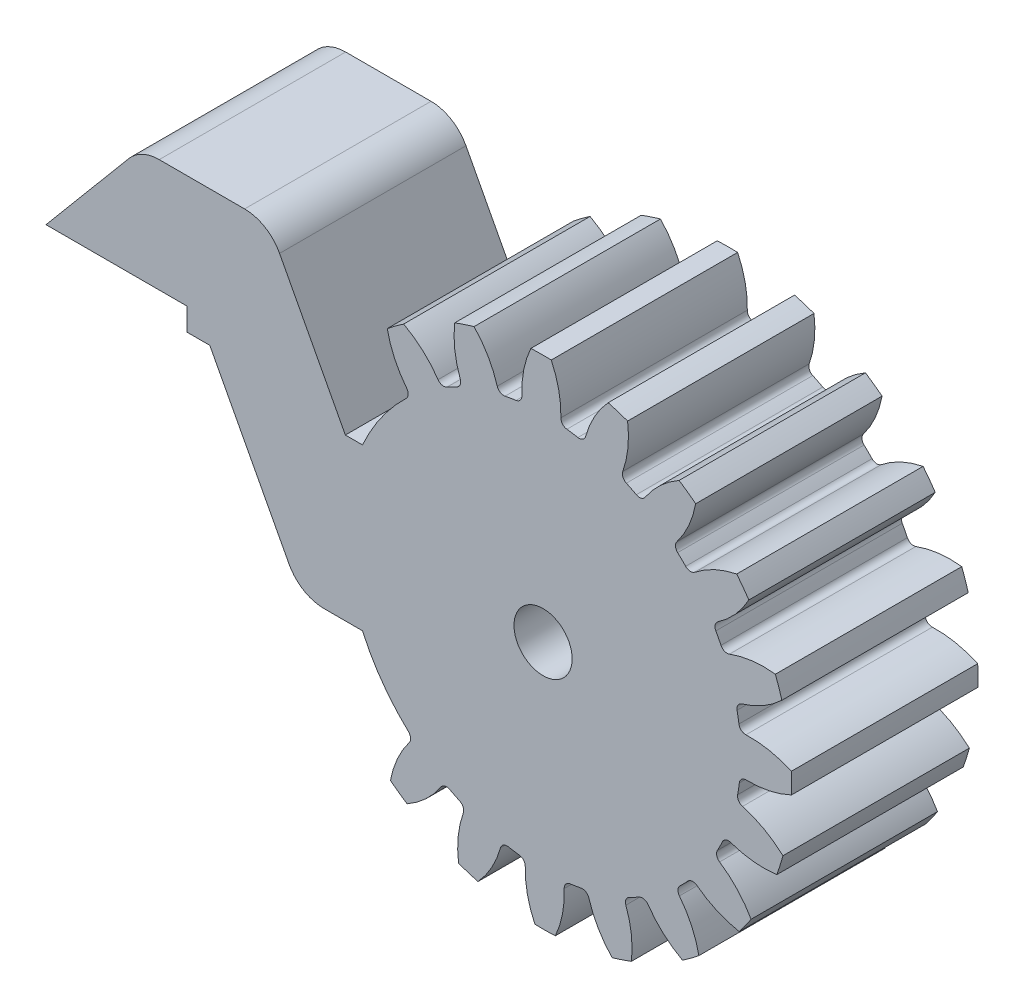
from build123d import *
from build123d.topology import SkipClean

# Parameters (mm, degrees)
BOSS_EXTRUDE1_DEPTH         = 16.5
FILLET1_R                   = 3.5
FINGER_GEARB_START          = -3.650955648
FINGER_GEARB_OUTLINE_R      = 2.575
FINGER_GEARB_DEPTH          = 16.5
BODY_MOVE_COPY1_START       = -3.650955648
BODY_MOVE_COPY1_OUTLINE_R   = 2.575
BODY_MOVE_COPY1_DEPTH       = 16.5
BODY_MOVE_COPY1_2_DEPTH     = 3.650955648
BODY_MOVE_COPY1_3_OUTLINE_R = 2.575
BODY_MOVE_COPY1_3_DEPTH     = 16.5
BOSS_EXTRUDE2_START         = 1.5
SKETCH2_R                   = 6
SKETCH2_R_2                 = 2.575
BOSS_EXTRUDE2_DEPTH         = 1.5


# Read off the part's stored shape, not the designer's step: Finger_GearB, Body-Move/Copy1
with BuildPart() as part:
    # Sketch1 → Boss-Extrude1 (new body)
    with BuildSketch(Plane.XY):
        Polygon((-22.5, 17.125), (-10, 17.125), (-10, 15.125), (-8, 15.125), (0, 0), (4, 0), (4, 14.25), (-2.809917355, 27.125), (-14.109003688, 27.125), align=None)
    extrude(amount=BOSS_EXTRUDE1_DEPTH)

    # Fillet1
    fillet1_edges = [part.edges().sort_by_distance(p)[0] for p in [
        (-14.109003688, 27.125, 8.25),
        (-2.809917355, 27.125, 8.25),
        (0, 0, 8.25),
    ]]
    fillet(fillet1_edges, radius=FILLET1_R)


with BuildPart() as body_2:
    # Finger_GearB outline → Finger_GearB (new body)
    with BuildSketch(Plane.XY.offset(FINGER_GEARB_START)):
        with BuildLine():
            Line((77.61017389, 18.534477569), (76.094052487, 18.534477569))
            ThreePointArc((76.094052487, 18.534477569), (74.346972801, 21.58609571), (72.025090867, 24.226838976))
            ThreePointArc((72.025090867, 24.226838976), (71.835721573, 24.615906562), (71.957307252, 25.03117905))
            ThreePointArc((71.957307252, 25.03117905), (73.00998807, 26.803667854), (73.619837802, 28.772915622))
            ThreePointArc((73.619837802, 28.772915622), (72.895015102, 29.3133273), (72.148600477, 29.823501717))
            ThreePointArc((72.148600477, 29.823501717), (70.483913473, 28.607495695), (69.149065858, 27.036497506))
            ThreePointArc((69.149065858, 27.036497506), (68.795740658, 26.786706355), (68.366272509, 26.839540291))
            ThreePointArc((68.366272509, 26.839540291), (67.926834814, 27.066738249), (67.481150824, 27.281424489))
            ThreePointArc((67.481150824, 27.281424489), (67.180821427, 27.592931422), (67.168130023, 28.025451069))
            ThreePointArc((67.168130023, 28.025451069), (67.621559812, 30.036484358), (67.593030347, 32.097804211))
            ThreePointArc((67.593030347, 32.097804211), (66.736686603, 32.387783727), (65.869151545, 32.642333627))
            ThreePointArc((65.869151545, 32.642333627), (64.661706649, 30.971426601), (63.877656265, 29.064827939))
            ThreePointArc((63.877656265, 29.064827939), (63.618813742, 28.718078945), (63.194038675, 28.635614048))
            ThreePointArc((63.194038675, 28.635614048), (62.705900562, 28.715898431), (62.215688203, 28.782353252))
            ThreePointArc((62.215688203, 28.782353252), (61.833797036, 28.985807062), (61.688070873, 29.393235831))
            ThreePointArc((61.688070873, 29.393235831), (61.497864765, 31.445959656), (60.833748767, 33.397575245))
            ThreePointArc((60.833748767, 33.397575245), (59.92970887, 33.408737383), (59.025973755, 33.382745648))
            ThreePointArc((59.025973755, 33.382745648), (58.393964085, 31.42049764), (58.237459247, 29.364929665))
            ThreePointArc((58.237459247, 29.364929665), (58.09843671, 28.955165037), (57.71993467, 28.745473545))
            ThreePointArc((57.71993467, 28.745473545), (57.230878497, 28.670985558), (56.74412317, 28.582703898))
            ThreePointArc((56.74412317, 28.582703898), (56.318052403, 28.65818911), (56.053556172, 29.000645034))
            ThreePointArc((56.053556172, 29.000645034), (55.238332867, 30.894124485), (54.003638636, 32.544998078))
            ThreePointArc((54.003638636, 32.544998078), (53.14039631, 32.276250211), (52.288925028, 31.972261093))
            ThreePointArc((52.288925028, 31.972261093), (52.294216095, 29.91075061), (52.780576586, 27.907426637))
            ThreePointArc((52.780576586, 27.907426637), (52.77498253, 27.474756991), (52.479803933, 27.158364968))
            ThreePointArc((52.479803933, 27.158364968), (52.037701927, 26.936396014), (51.602050635, 26.702019498))
            ThreePointArc((51.602050635, 26.702019498), (51.173507042, 26.642147093), (50.816131477, 26.886108201))
            ThreePointArc((50.816131477, 26.886108201), (49.455690713, 28.434996316), (47.771278722, 29.623528904))
            ThreePointArc((47.771278722, 29.623528904), (47.033334142, 29.101177945), (46.317474634, 28.548948017))
            ThreePointArc((46.317474634, 28.548948017), (46.959548511, 26.589970068), (48.041165978, 24.834989407))
            ThreePointArc((48.041165978, 24.834989407), (48.169547988, 24.421767462), (47.986586972, 24.029645564))
            ThreePointArc((47.986586972, 24.029645564), (47.634715158, 23.681923511), (47.292812483, 23.324394546))
            ThreePointArc((47.292812483, 23.324394546), (46.903744897, 23.135025251), (46.48847241, 23.25661093))
            ThreePointArc((46.48847241, 23.25661093), (44.715983606, 24.309291748), (42.746735838, 24.91914148))
            ThreePointArc((42.746735838, 24.91914148), (42.206324159, 24.194318781), (41.696149742, 23.447904155))
            ThreePointArc((41.696149742, 23.447904155), (42.912155765, 21.783217152), (44.483153954, 20.448369537))
            ThreePointArc((44.483153954, 20.448369537), (44.732945105, 20.095044337), (44.680111168, 19.665576187))
            ThreePointArc((44.680111168, 19.665576187), (44.45291321, 19.226138492), (44.23822697, 18.780454503))
            ThreePointArc((44.23822697, 18.780454503), (43.926720037, 18.480125105), (43.494200391, 18.467433702))
            ThreePointArc((43.494200391, 18.467433702), (41.483167101, 18.920863491), (39.421847248, 18.892334026))
            ThreePointArc((39.421847248, 18.892334026), (39.131867732, 18.035990281), (38.877317833, 17.168455223))
            ThreePointArc((38.877317833, 17.168455223), (40.548224858, 15.961010327), (42.454823521, 15.176959943))
            ThreePointArc((42.454823521, 15.176959943), (42.801572514, 14.918117419), (42.884037412, 14.493342353))
            ThreePointArc((42.884037412, 14.493342353), (42.803753029, 14.00520424), (42.737298208, 13.514991881))
            ThreePointArc((42.737298208, 13.514991881), (42.533844397, 13.133100715), (42.126415629, 12.987374551))
            ThreePointArc((42.126415629, 12.987374551), (40.073691804, 12.797168444), (38.122076215, 12.133052445))
            ThreePointArc((38.122076215, 12.133052445), (38.110914076, 11.229012548), (38.136905812, 10.325277433))
            ThreePointArc((38.136905812, 10.325277433), (40.09915382, 9.693267764), (42.154721795, 9.536762925))
            ThreePointArc((42.154721795, 9.536762925), (42.564486423, 9.397740388), (42.774177915, 9.019238348))
            ThreePointArc((42.774177915, 9.019238348), (42.848665902, 8.530182176), (42.936947561, 8.043426849))
            ThreePointArc((42.936947561, 8.043426849), (42.861462349, 7.617356081), (42.519006425, 7.35285985))
            ThreePointArc((42.519006425, 7.35285985), (40.625526975, 6.537636546), (38.974653382, 5.302942314))
            ThreePointArc((38.974653382, 5.302942314), (39.243401249, 4.439699989), (39.547390367, 3.588228707))
            ThreePointArc((39.547390367, 3.588228707), (41.60890085, 3.593519773), (43.612224822, 4.079880264))
            ThreePointArc((43.612224822, 4.079880264), (44.044894468, 4.074286209), (44.361286491, 3.779107612))
            ThreePointArc((44.361286491, 3.779107612), (44.583255445, 3.337005606), (44.817631961, 2.901354313))
            ThreePointArc((44.817631961, 2.901354313), (44.877504366, 2.47281072), (44.633543258, 2.115435156))
            ThreePointArc((44.633543258, 2.115435156), (43.084655144, 0.754994391), (41.896122556, -0.929417599))
            ThreePointArc((41.896122556, -0.929417599), (42.418473515, -1.66736218), (42.970703443, -2.383221687))
            ThreePointArc((42.970703443, -2.383221687), (44.929681392, -1.741147811), (46.684662053, -0.659530344))
            ThreePointArc((46.684662053, -0.659530344), (47.097883998, -0.531148333), (47.490005895, -0.71410935))
            ThreePointArc((47.490005895, -0.71410935), (47.837727948, -1.065981164), (48.195256914, -1.407883838))
            ThreePointArc((48.195256914, -1.407883838), (48.384626208, -1.796951424), (48.263040529, -2.212223912))
            ThreePointArc((48.263040529, -2.212223912), (47.210359711, -3.984712716), (46.600509979, -5.953960484))
            ThreePointArc((46.600509979, -5.953960484), (47.325332679, -6.494372162), (48.071747304, -7.004546579))
            ThreePointArc((48.071747304, -7.004546579), (49.736434308, -5.788540557), (51.071281923, -4.217542368))
            ThreePointArc((51.071281923, -4.217542368), (51.424607123, -3.967751217), (51.854075272, -4.020585153))
            ThreePointArc((51.854075272, -4.020585153), (52.293512967, -4.247783111), (52.739196957, -4.462469351))
            ThreePointArc((52.739196957, -4.462469351), (53.039526354, -4.773976284), (53.052217758, -5.206495931))
            ThreePointArc((53.052217758, -5.206495931), (52.598787969, -7.21752922), (52.627317434, -9.278849073))
            ThreePointArc((52.627317434, -9.278849073), (53.483661178, -9.568828589), (54.351196236, -9.823378489))
            ThreePointArc((54.351196236, -9.823378489), (55.558641132, -8.152471463), (56.342691516, -6.2458728))
            ThreePointArc((56.342691516, -6.2458728), (56.60153404, -5.899123807), (57.026309106, -5.81665891))
            ThreePointArc((57.026309106, -5.81665891), (57.514447219, -5.896943293), (58.004659578, -5.963398114))
            ThreePointArc((58.004659578, -5.963398114), (58.386550745, -6.166851924), (58.532276908, -6.574280693))
            ThreePointArc((58.532276908, -6.574280693), (58.722483016, -8.627004518), (59.386599014, -10.578620107))
            ThreePointArc((59.386599014, -10.578620107), (60.290638911, -10.589782245), (61.194374026, -10.56379051))
            ThreePointArc((61.194374026, -10.56379051), (61.826383696, -8.601542502), (61.982888534, -6.545974527))
            ThreePointArc((61.982888534, -6.545974527), (62.121911071, -6.136209899), (62.500413111, -5.926518407))
            ThreePointArc((62.500413111, -5.926518407), (62.989469284, -5.85203042), (63.476224611, -5.76374876))
            ThreePointArc((63.476224611, -5.76374876), (63.902295378, -5.839233972), (64.166791609, -6.181689896))
            ThreePointArc((64.166791609, -6.181689896), (64.982014914, -8.075169347), (66.216709145, -9.72604294))
            ThreePointArc((66.216709145, -9.72604294), (67.079951471, -9.457295073), (67.931422753, -9.153305954))
            ThreePointArc((67.931422753, -9.153305954), (67.926131686, -7.091795471), (67.439771195, -5.088471499))
            ThreePointArc((67.439771195, -5.088471499), (67.445365251, -4.655801853), (67.740543848, -4.33940983))
            ThreePointArc((67.740543848, -4.33940983), (68.182645854, -4.117440876), (68.618297146, -3.88306436))
            ThreePointArc((68.618297146, -3.88306436), (69.046840739, -3.823191955), (69.404216304, -4.067153063))
            ThreePointArc((69.404216304, -4.067153063), (70.764657068, -5.616041178), (72.449069059, -6.804573766))
            ThreePointArc((72.449069059, -6.804573766), (73.187013639, -6.282222807), (73.902873147, -5.729992878))
            ThreePointArc((73.902873147, -5.729992878), (73.26079927, -3.77101493), (72.179181803, -2.016034269))
            ThreePointArc((72.179181803, -2.016034269), (72.050799793, -1.602812324), (72.233760809, -1.210690426))
            ThreePointArc((72.233760809, -1.210690426), (74.429972152, 1.349985646), (76.094052487, 4.284477569))
            Line((76.094052487, 4.284477569), (77.61017389, 4.284477569))
            Line((77.61017389, 4.284477569), (77.61017389, 18.534477569))
        make_face()
        with Locations((60.11017389, 11.409477569)):
            Circle(FINGER_GEARB_OUTLINE_R, mode=Mode.SUBTRACT)
    extrude(amount=FINGER_GEARB_DEPTH)

    # Body-Move/Copy1 outline → Body-Move/Copy1 (cut)
    with BuildSketch(Plane.XY.offset(BODY_MOVE_COPY1_START)):
        with BuildLine():
            ThreePointArc((42.737298208, 13.514991881), (42.701762775, 13.372050177), (42.632473024, 13.242073148))
            ThreePointArc((42.632473024, 13.242073148), (42.633997423, 13.236804391), (42.635520509, 13.231535255))
            ThreePointArc((42.635520509, 13.231535255), (42.613151873, 13.210351339), (42.590708961, 13.189246129))
            ThreePointArc((42.590708961, 13.189246129), (42.548940117, 13.146590132), (42.503138975, 13.108296192))
            ThreePointArc((42.503138975, 13.108296192), (40.906130237, 11.951968618), (39.091167465, 11.181617719))
            ThreePointArc((39.091167465, 11.181617719), (38.748711541, 10.917121488), (38.673226329, 10.49105072))
            ThreePointArc((38.673226329, 10.49105072), (38.71291693, 10.281816556), (38.750058374, 10.072114881))
            ThreePointArc((38.750058374, 10.072114881), (40.425833728, 9.635549156), (42.154721795, 9.536762925))
            ThreePointArc((42.154721795, 9.536762925), (42.564486423, 9.397740388), (42.774177915, 9.019238348))
            ThreePointArc((42.774177915, 9.019238348), (42.814905275, 8.740454617), (42.860115517, 8.462362688))
            ThreePointArc((42.860115517, 8.462362688), (43.169086228, 8.341580653), (43.473268079, 8.209200136))
            ThreePointArc((43.473268079, 8.209200136), (43.499259814, 7.305465021), (43.488097676, 6.401425124))
            ThreePointArc((43.488097676, 6.401425124), (41.536482087, 5.737309125), (39.483758262, 5.547103018))
            ThreePointArc((39.483758262, 5.547103018), (39.285142564, 5.518587941), (39.107034921, 5.426181381))
            ThreePointArc((39.107034921, 5.426181381), (39.063112332, 5.385855252), (39.019464925, 5.345231435))
            ThreePointArc((39.019464925, 5.345231435), (38.997841172, 5.319404322), (38.977700867, 5.292404422))
            ThreePointArc((38.977700867, 5.292404422), (39.245139542, 4.434497882), (39.547390367, 3.588228707))
            ThreePointArc((39.547390367, 3.588228707), (41.60890085, 3.593519773), (43.612224822, 4.079880264))
            ThreePointArc((43.612224822, 4.079880264), (44.044894468, 4.074286209), (44.361286491, 3.779107612))
            ThreePointArc((44.361286491, 3.779107612), (44.583255445, 3.337005606), (44.817631961, 2.901354313))
            ThreePointArc((44.817631961, 2.901354313), (44.877504366, 2.47281072), (44.633543258, 2.115435156))
            ThreePointArc((44.633543258, 2.115435156), (43.084655144, 0.754994391), (41.896122556, -0.929417599))
            ThreePointArc((41.896122556, -0.929417599), (42.418473515, -1.66736218), (42.970703443, -2.383221687))
            ThreePointArc((42.970703443, -2.383221687), (44.929681392, -1.741147811), (46.684662053, -0.659530344))
            ThreePointArc((46.684662053, -0.659530344), (47.097883998, -0.531148333), (47.490005895, -0.71410935))
            ThreePointArc((47.490005895, -0.71410935), (47.837727948, -1.065981164), (48.195256914, -1.407883838))
            ThreePointArc((48.195256914, -1.407883838), (48.384626208, -1.796951424), (48.263040529, -2.212223912))
            ThreePointArc((48.263040529, -2.212223912), (47.210359711, -3.984712716), (46.600509979, -5.953960484))
            ThreePointArc((46.600509979, -5.953960484), (47.325332679, -6.494372162), (48.071747304, -7.004546579))
            ThreePointArc((48.071747304, -7.004546579), (49.736434308, -5.788540557), (51.071281923, -4.217542368))
            ThreePointArc((51.071281923, -4.217542368), (51.424607123, -3.967751217), (51.854075272, -4.020585153))
            ThreePointArc((51.854075272, -4.020585153), (52.293512967, -4.247783111), (52.739196957, -4.462469351))
            ThreePointArc((52.739196957, -4.462469351), (53.039526354, -4.773976284), (53.052217758, -5.206495931))
            ThreePointArc((53.052217758, -5.206495931), (52.598787969, -7.21752922), (52.627317434, -9.278849073))
            ThreePointArc((52.627317434, -9.278849073), (53.483661178, -9.568828589), (54.351196236, -9.823378489))
            ThreePointArc((54.351196236, -9.823378489), (55.558641132, -8.152471463), (56.342691516, -6.2458728))
            ThreePointArc((56.342691516, -6.2458728), (56.60153404, -5.899123807), (57.026309106, -5.81665891))
            ThreePointArc((57.026309106, -5.81665891), (57.514447219, -5.896943293), (58.004659578, -5.963398114))
            ThreePointArc((58.004659578, -5.963398114), (58.386550745, -6.166851924), (58.532276908, -6.574280693))
            ThreePointArc((58.532276908, -6.574280693), (58.722483016, -8.627004518), (59.386599014, -10.578620107))
            ThreePointArc((59.386599014, -10.578620107), (60.290638911, -10.589782245), (61.194374026, -10.56379051))
            ThreePointArc((61.194374026, -10.56379051), (61.826383696, -8.601542502), (61.982888534, -6.545974527))
            ThreePointArc((61.982888534, -6.545974527), (62.121911071, -6.136209899), (62.500413111, -5.926518407))
            ThreePointArc((62.500413111, -5.926518407), (62.989469284, -5.85203042), (63.476224611, -5.76374876))
            ThreePointArc((63.476224611, -5.76374876), (63.902295378, -5.839233972), (64.166791609, -6.181689896))
            ThreePointArc((64.166791609, -6.181689896), (64.982014914, -8.075169347), (66.216709145, -9.72604294))
            ThreePointArc((66.216709145, -9.72604294), (67.079951471, -9.457295073), (67.931422753, -9.153305954))
            ThreePointArc((67.931422753, -9.153305954), (67.926131686, -7.091795471), (67.439771195, -5.088471499))
            ThreePointArc((67.439771195, -5.088471499), (67.445365251, -4.655801853), (67.740543848, -4.33940983))
            ThreePointArc((67.740543848, -4.33940983), (68.182645854, -4.117440876), (68.618297146, -3.88306436))
            ThreePointArc((68.618297146, -3.88306436), (69.046840739, -3.823191955), (69.404216304, -4.067153063))
            ThreePointArc((69.404216304, -4.067153063), (70.764657068, -5.616041178), (72.449069059, -6.804573766))
            ThreePointArc((72.449069059, -6.804573766), (73.187013639, -6.282222807), (73.902873147, -5.729992878))
            ThreePointArc((73.902873147, -5.729992878), (73.26079927, -3.77101493), (72.179181803, -2.016034269))
            ThreePointArc((72.179181803, -2.016034269), (72.050799793, -1.602812324), (72.233760809, -1.210690426))
            ThreePointArc((72.233760809, -1.210690426), (74.429972152, 1.349985646), (76.094052487, 4.284477569))
            Line((76.094052487, 4.284477569), (77.61017389, 4.284477569))
            Line((77.61017389, 4.284477569), (77.61017389, 18.534477569))
            Line((77.61017389, 18.534477569), (76.094052487, 18.534477569))
            ThreePointArc((76.094052487, 18.534477569), (74.346972801, 21.58609571), (72.025090867, 24.226838976))
            ThreePointArc((72.025090867, 24.226838976), (71.835721573, 24.615906562), (71.957307252, 25.03117905))
            ThreePointArc((71.957307252, 25.03117905), (73.00998807, 26.803667854), (73.619837802, 28.772915622))
            ThreePointArc((73.619837802, 28.772915622), (72.895015102, 29.3133273), (72.148600477, 29.823501717))
            ThreePointArc((72.148600477, 29.823501717), (70.483913473, 28.607495695), (69.149065858, 27.036497506))
            ThreePointArc((69.149065858, 27.036497506), (68.795740658, 26.786706355), (68.366272509, 26.839540291))
            ThreePointArc((68.366272509, 26.839540291), (67.926834814, 27.066738249), (67.481150824, 27.281424489))
            ThreePointArc((67.481150824, 27.281424489), (67.180821427, 27.592931422), (67.168130023, 28.025451069))
            ThreePointArc((67.168130023, 28.025451069), (67.621559812, 30.036484358), (67.593030347, 32.097804211))
            ThreePointArc((67.593030347, 32.097804211), (66.736686603, 32.387783727), (65.869151545, 32.642333627))
            ThreePointArc((65.869151545, 32.642333627), (64.661706649, 30.971426601), (63.877656265, 29.064827939))
            ThreePointArc((63.877656265, 29.064827939), (63.618813742, 28.718078945), (63.194038675, 28.635614048))
            ThreePointArc((63.194038675, 28.635614048), (62.705900562, 28.715898431), (62.215688203, 28.782353252))
            ThreePointArc((62.215688203, 28.782353252), (61.833797036, 28.985807062), (61.688070873, 29.393235831))
            ThreePointArc((61.688070873, 29.393235831), (61.497864765, 31.445959656), (60.833748767, 33.397575245))
            ThreePointArc((60.833748767, 33.397575245), (59.92970887, 33.408737383), (59.025973755, 33.382745648))
            ThreePointArc((59.025973755, 33.382745648), (58.393964085, 31.42049764), (58.237459247, 29.364929665))
            ThreePointArc((58.237459247, 29.364929665), (58.09843671, 28.955165037), (57.71993467, 28.745473545))
            ThreePointArc((57.71993467, 28.745473545), (57.230878497, 28.670985558), (56.74412317, 28.582703898))
            ThreePointArc((56.74412317, 28.582703898), (56.318052403, 28.65818911), (56.053556172, 29.000645034))
            ThreePointArc((56.053556172, 29.000645034), (55.238332867, 30.894124485), (54.003638636, 32.544998078))
            ThreePointArc((54.003638636, 32.544998078), (53.14039631, 32.276250211), (52.288925028, 31.972261093))
            ThreePointArc((52.288925028, 31.972261093), (52.294216095, 29.91075061), (52.780576586, 27.907426637))
            ThreePointArc((52.780576586, 27.907426637), (52.77498253, 27.474756991), (52.479803933, 27.158364968))
            ThreePointArc((52.479803933, 27.158364968), (52.037701927, 26.936396014), (51.602050635, 26.702019498))
            ThreePointArc((51.602050635, 26.702019498), (51.173507042, 26.642147093), (50.816131477, 26.886108201))
            ThreePointArc((50.816131477, 26.886108201), (49.455690713, 28.434996316), (47.771278722, 29.623528904))
            ThreePointArc((47.771278722, 29.623528904), (47.033334142, 29.101177945), (46.317474634, 28.548948017))
            ThreePointArc((46.317474634, 28.548948017), (46.959548511, 26.589970068), (48.041165978, 24.834989407))
            ThreePointArc((48.041165978, 24.834989407), (48.169547988, 24.421767462), (47.986586972, 24.029645564))
            ThreePointArc((47.986586972, 24.029645564), (47.634715158, 23.681923511), (47.292812483, 23.324394546))
            ThreePointArc((47.292812483, 23.324394546), (46.903744897, 23.135025251), (46.48847241, 23.25661093))
            ThreePointArc((46.48847241, 23.25661093), (44.715983606, 24.309291748), (42.746735838, 24.91914148))
            ThreePointArc((42.746735838, 24.91914148), (42.206324159, 24.194318781), (41.696149742, 23.447904155))
            ThreePointArc((41.696149742, 23.447904155), (42.912155765, 21.783217152), (44.483153954, 20.448369537))
            ThreePointArc((44.483153954, 20.448369537), (44.732945105, 20.095044337), (44.680111168, 19.665576187))
            ThreePointArc((44.680111168, 19.665576187), (44.45291321, 19.226138492), (44.23822697, 18.780454503))
            ThreePointArc((44.23822697, 18.780454503), (43.926720037, 18.480125105), (43.494200391, 18.467433702))
            ThreePointArc((43.494200391, 18.467433702), (41.483167101, 18.920863491), (39.421847248, 18.892334026))
            ThreePointArc((39.421847248, 18.892334026), (39.131867732, 18.035990281), (38.877317833, 17.168455223))
            ThreePointArc((38.877317833, 17.168455223), (40.548224858, 15.961010327), (42.454823521, 15.176959943))
            ThreePointArc((42.454823521, 15.176959943), (42.801572514, 14.918117419), (42.884037412, 14.493342353))
            ThreePointArc((42.884037412, 14.493342353), (42.803753029, 14.00520424), (42.737298208, 13.514991881))
        make_face()
        with Locations((60.11017389, 11.409477569)):
            Circle(BODY_MOVE_COPY1_OUTLINE_R, mode=Mode.SUBTRACT)
    extrude(amount=BODY_MOVE_COPY1_DEPTH, mode=Mode.SUBTRACT)

    # Body-Move_Copy1 2 outline → Body-Move_Copy1 2 (cut)
    with BuildSketch(Plane.XY.offset(BODY_MOVE_COPY1_START)):
        with BuildLine():
            ThreePointArc((42.635520509, 13.231535255), (42.633997423, 13.236804391), (42.632473024, 13.242073148))
            ThreePointArc((42.632473024, 13.242073148), (42.612332717, 13.215073245), (42.590708961, 13.189246129))
            ThreePointArc((42.590708961, 13.189246129), (42.613151873, 13.210351339), (42.635520509, 13.231535255))
        make_face()
        with BuildLine():
            ThreePointArc((38.974653382, 5.302942314), (38.976176468, 5.297673178), (38.977700867, 5.292404422))
            ThreePointArc((38.977700867, 5.292404422), (38.997841172, 5.319404322), (39.019464925, 5.345231435))
            ThreePointArc((39.019464925, 5.345231435), (38.997022016, 5.324126228), (38.974653382, 5.302942314))
        make_face()
        with BuildLine():
            ThreePointArc((39.091167465, 11.181617719), (40.906130237, 11.951968618), (42.503138975, 13.108296192))
            ThreePointArc((42.503138975, 13.108296192), (42.32503133, 13.015889629), (42.126415629, 12.987374551))
            ThreePointArc((42.126415629, 12.987374551), (40.073691804, 12.797168444), (38.122076215, 12.133052445))
            ThreePointArc((38.122076215, 12.133052445), (38.110914076, 11.229012548), (38.136905812, 10.325277433))
            ThreePointArc((38.136905812, 10.325277433), (38.441087663, 10.192896916), (38.750058374, 10.072114881))
            ThreePointArc((38.750058374, 10.072114881), (38.71291693, 10.281816556), (38.673226329, 10.49105072))
            ThreePointArc((38.673226329, 10.49105072), (38.748711541, 10.917121488), (39.091167465, 11.181617719))
        make_face()
        with BuildLine():
            ThreePointArc((42.519006425, 7.35285985), (40.704043657, 6.582508952), (39.107034921, 5.426181381))
            ThreePointArc((39.107034921, 5.426181381), (39.285142564, 5.518587941), (39.483758262, 5.547103018))
            ThreePointArc((39.483758262, 5.547103018), (41.536482087, 5.737309125), (43.488097676, 6.401425124))
            ThreePointArc((43.488097676, 6.401425124), (43.499259814, 7.305465021), (43.473268079, 8.209200136))
            ThreePointArc((43.473268079, 8.209200136), (43.169086228, 8.341580653), (42.860115517, 8.462362688))
            ThreePointArc((42.860115517, 8.462362688), (42.897256961, 8.252661013), (42.936947561, 8.043426849))
            ThreePointArc((42.936947561, 8.043426849), (42.861462349, 7.617356081), (42.519006425, 7.35285985))
        make_face()
    extrude(amount=BODY_MOVE_COPY1_2_DEPTH, mode=Mode.SUBTRACT)

    # Body-Move_Copy1 3 outline → Body-Move_Copy1 3 (add)
    with SkipClean():  # the faces are left unmerged after this step: merging them gives an invalid solid
        with BuildSketch(Plane.XY):
            with BuildLine():
                Line((4, 0), (5.516121403, 0))
                ThreePointArc((5.516121403, 0), (7.26320109, -3.051618141), (9.585083024, -5.692361407))
                ThreePointArc((9.585083024, -5.692361407), (9.774452318, -6.081428993), (9.652866639, -6.496701481))
                ThreePointArc((9.652866639, -6.496701481), (8.600185821, -8.269190285), (7.990336089, -10.238438053))
                ThreePointArc((7.990336089, -10.238438053), (8.715158789, -10.778849731), (9.461573414, -11.289024148))
                ThreePointArc((9.461573414, -11.289024148), (11.126260417, -10.073018126), (12.461108032, -8.502019937))
                ThreePointArc((12.461108032, -8.502019937), (12.814433232, -8.252228786), (13.243901382, -8.305062722))
                ThreePointArc((13.243901382, -8.305062722), (13.683339077, -8.53226068), (14.129023066, -8.74694692))
                ThreePointArc((14.129023066, -8.74694692), (14.429352464, -9.058453853), (14.442043868, -9.4909735))
                ThreePointArc((14.442043868, -9.4909735), (13.988614078, -11.502006789), (14.017143543, -13.563326642))
                ThreePointArc((14.017143543, -13.563326642), (14.873487288, -13.853306158), (15.741022346, -14.107856058))
                ThreePointArc((15.741022346, -14.107856058), (16.948467242, -12.436949032), (17.732517626, -10.530350369))
                ThreePointArc((17.732517626, -10.530350369), (17.991360149, -10.183601376), (18.416135216, -10.101136479))
                ThreePointArc((18.416135216, -10.101136479), (18.904273329, -10.181420862), (19.394485688, -10.247875683))
                ThreePointArc((19.394485688, -10.247875683), (19.776376854, -10.451329494), (19.922103018, -10.858758262))
                ThreePointArc((19.922103018, -10.858758262), (20.112309125, -12.911482087), (20.776425124, -14.863097676))
                ThreePointArc((20.776425124, -14.863097676), (21.680465021, -14.874259814), (22.584200136, -14.848268079))
                ThreePointArc((22.584200136, -14.848268079), (23.216209805, -12.886020071), (23.372714644, -10.830452096))
                ThreePointArc((23.372714644, -10.830452096), (23.511737181, -10.420687468), (23.890239221, -10.210995976))
                ThreePointArc((23.890239221, -10.210995976), (24.379295393, -10.136507989), (24.86605072, -10.048226329))
                ThreePointArc((24.86605072, -10.048226329), (25.292121488, -10.123711541), (25.556617719, -10.466167465))
                ThreePointArc((25.556617719, -10.466167465), (26.371841023, -12.359646916), (27.606535255, -14.010520509))
                ThreePointArc((27.606535255, -14.010520509), (28.46977758, -13.741772642), (29.321248862, -13.437783523))
                ThreePointArc((29.321248862, -13.437783523), (29.315957796, -11.37627304), (28.829597305, -9.372949068))
                ThreePointArc((28.829597305, -9.372949068), (28.83519136, -8.940279422), (29.130369957, -8.623887399))
                ThreePointArc((29.130369957, -8.623887399), (29.572471963, -8.401918445), (30.008123256, -8.167541929))
                ThreePointArc((30.008123256, -8.167541929), (30.436666849, -8.107669524), (30.794042413, -8.351630632))
                ThreePointArc((30.794042413, -8.351630632), (32.154483178, -9.900518747), (33.838895168, -11.089051335))
                ThreePointArc((33.838895168, -11.089051335), (34.576839749, -10.566700376), (35.292699256, -10.014470447))
                ThreePointArc((35.292699256, -10.014470447), (34.65062538, -8.055492499), (33.569007913, -6.300511838))
                ThreePointArc((33.569007913, -6.300511838), (33.440625902, -5.887289893), (33.623586919, -5.495167995))
                ThreePointArc((33.623586919, -5.495167995), (33.975458733, -5.147445942), (34.317361407, -4.789916976))
                ThreePointArc((34.317361407, -4.789916976), (34.706428993, -4.600547682), (35.121701481, -4.722133361))
                ThreePointArc((35.121701481, -4.722133361), (36.894190285, -5.774814179), (38.863438053, -6.384663911))
                ThreePointArc((38.863438053, -6.384663911), (39.403849731, -5.659841211), (39.914024148, -4.913426586))
                ThreePointArc((39.914024148, -4.913426586), (38.698018126, -3.248739583), (37.127019937, -1.913891968))
                ThreePointArc((37.127019937, -1.913891968), (36.877228786, -1.560566768), (36.930062722, -1.131098618))
                ThreePointArc((36.930062722, -1.131098618), (37.15726068, -0.691660923), (37.37194692, -0.245976934))
                ThreePointArc((37.37194692, -0.245976934), (37.683453853, 0.054352464), (38.1159735, 0.067043868))
                ThreePointArc((38.1159735, 0.067043868), (40.127006789, -0.386385922), (42.188326642, -0.357856457))
                ThreePointArc((42.188326642, -0.357856457), (42.478306158, 0.498487288), (42.732856058, 1.366022346))
                ThreePointArc((42.732856058, 1.366022346), (41.061949032, 2.573467242), (39.155350369, 3.357517626))
                ThreePointArc((39.155350369, 3.357517626), (38.808601376, 3.616360149), (38.726136479, 4.041135216))
                ThreePointArc((38.726136479, 4.041135216), (38.806420862, 4.529273329), (38.872875683, 5.019485688))
                ThreePointArc((38.872875683, 5.019485688), (39.076329494, 5.401376854), (39.483758262, 5.547103018))
                ThreePointArc((39.483758262, 5.547103018), (41.536482087, 5.737309125), (43.488097676, 6.401425124))
                ThreePointArc((43.488097676, 6.401425124), (43.499259814, 7.305465021), (43.473268079, 8.209200136))
                ThreePointArc((43.473268079, 8.209200136), (41.511020071, 8.841209805), (39.455452096, 8.997714644))
                ThreePointArc((39.455452096, 8.997714644), (39.045687468, 9.136737181), (38.835995976, 9.515239221))
                ThreePointArc((38.835995976, 9.515239221), (38.761507989, 10.004295393), (38.673226329, 10.49105072))
                ThreePointArc((38.673226329, 10.49105072), (38.748711541, 10.917121488), (39.091167465, 11.181617719))
                ThreePointArc((39.091167465, 11.181617719), (40.984646916, 11.996841023), (42.635520509, 13.231535255))
                ThreePointArc((42.635520509, 13.231535255), (42.366772642, 14.09477758), (42.062783523, 14.946248862))
                ThreePointArc((42.062783523, 14.946248862), (40.00127304, 14.940957796), (37.997949068, 14.454597305))
                ThreePointArc((37.997949068, 14.454597305), (37.565279422, 14.46019136), (37.248887399, 14.755369957))
                ThreePointArc((37.248887399, 14.755369957), (37.026918445, 15.197471963), (36.792541929, 15.633123256))
                ThreePointArc((36.792541929, 15.633123256), (36.732669524, 16.061666849), (36.976630632, 16.419042413))
                ThreePointArc((36.976630632, 16.419042413), (38.525518747, 17.779483178), (39.714051335, 19.463895168))
                ThreePointArc((39.714051335, 19.463895168), (39.191700376, 20.201839749), (38.639470447, 20.917699256))
                ThreePointArc((38.639470447, 20.917699256), (36.680492499, 20.27562538), (34.925511838, 19.194007913))
                ThreePointArc((34.925511838, 19.194007913), (34.512289893, 19.065625902), (34.120167995, 19.248586919))
                ThreePointArc((34.120167995, 19.248586919), (33.772445942, 19.600458733), (33.414916976, 19.942361407))
                ThreePointArc((33.414916976, 19.942361407), (33.225547682, 20.331428993), (33.347133361, 20.746701481))
                ThreePointArc((33.347133361, 20.746701481), (34.399814179, 22.519190285), (35.009663911, 24.488438053))
                ThreePointArc((35.009663911, 24.488438053), (34.284841211, 25.028849731), (33.538426586, 25.539024148))
                ThreePointArc((33.538426586, 25.539024148), (31.873739583, 24.323018126), (30.538891968, 22.752019937))
                ThreePointArc((30.538891968, 22.752019937), (30.185566768, 22.502228786), (29.756098618, 22.555062722))
                ThreePointArc((29.756098618, 22.555062722), (29.316660923, 22.78226068), (28.870976934, 22.99694692))
                ThreePointArc((28.870976934, 22.99694692), (28.570647536, 23.308453853), (28.557956132, 23.7409735))
                ThreePointArc((28.557956132, 23.7409735), (29.011385922, 25.752006789), (28.982856457, 27.813326642))
                ThreePointArc((28.982856457, 27.813326642), (28.126512712, 28.103306158), (27.258977654, 28.357856058))
                ThreePointArc((27.258977654, 28.357856058), (26.051532758, 26.686949032), (25.267482374, 24.780350369))
                ThreePointArc((25.267482374, 24.780350369), (25.008639851, 24.433601376), (24.583864784, 24.351136479))
                ThreePointArc((24.583864784, 24.351136479), (24.095726671, 24.431420862), (23.605514312, 24.497875683))
                ThreePointArc((23.605514312, 24.497875683), (23.223623146, 24.701329494), (23.077896982, 25.108758262))
                ThreePointArc((23.077896982, 25.108758262), (22.887690875, 27.161482087), (22.223574876, 29.113097676))
                ThreePointArc((22.223574876, 29.113097676), (21.319534979, 29.124259814), (20.415799864, 29.098268079))
                ThreePointArc((20.415799864, 29.098268079), (19.783790195, 27.136020071), (19.627285356, 25.080452096))
                ThreePointArc((19.627285356, 25.080452096), (19.488262819, 24.670687468), (19.109760779, 24.460995976))
                ThreePointArc((19.109760779, 24.460995976), (18.620704607, 24.386507989), (18.13394928, 24.298226329))
                ThreePointArc((18.13394928, 24.298226329), (17.707878512, 24.373711541), (17.443382281, 24.716167465))
                ThreePointArc((17.443382281, 24.716167465), (16.628158977, 26.609646916), (15.393464745, 28.260520509))
                ThreePointArc((15.393464745, 28.260520509), (14.53022242, 27.991772642), (13.678751138, 27.687783523))
                ThreePointArc((13.678751138, 27.687783523), (13.684042204, 25.62627304), (14.170402695, 23.622949068))
                ThreePointArc((14.170402695, 23.622949068), (14.16480864, 23.190279422), (13.869630043, 22.873887399))
                ThreePointArc((13.869630043, 22.873887399), (13.427528037, 22.651918445), (12.991876744, 22.417541929))
                ThreePointArc((12.991876744, 22.417541929), (12.563333151, 22.357669524), (12.205957587, 22.601630632))
                ThreePointArc((12.205957587, 22.601630632), (10.845516822, 24.150518747), (9.161104832, 25.339051335))
                ThreePointArc((9.161104832, 25.339051335), (8.423160251, 24.816700376), (7.707300744, 24.264470447))
                ThreePointArc((7.707300744, 24.264470447), (8.34937462, 22.305492499), (9.430992087, 20.550511838))
                ThreePointArc((9.430992087, 20.550511838), (9.559374098, 20.137289893), (9.376413081, 19.745167995))
                ThreePointArc((9.376413081, 19.745167995), (7.180201739, 17.184491923), (5.516121403, 14.25))
                Line((5.516121403, 14.25), (4, 14.25))
                Line((4, 14.25), (4, 0))
            make_face()
            with Locations((21.5, 7.125)):
                Circle(BODY_MOVE_COPY1_3_OUTLINE_R, mode=Mode.SUBTRACT)
        extrude(amount=BODY_MOVE_COPY1_3_DEPTH)


with BuildPart() as part_1:
    add(part.part)

    # Combine1: union body 2
    add(body_2.part)

    # Sketch2 → Boss-Extrude2 (add)
    with SkipClean():  # the faces are left unmerged after this step: merging them gives an invalid solid
        with BuildSketch(Plane(origin=(0, 0, 0), x_dir=(-1, 0, 0), z_dir=(0, 0, -1)).offset(BOSS_EXTRUDE2_START)):
            with Locations(Location((-21.5, 7.125, 0), (0, 0, 180))):
                Circle(SKETCH2_R)
            with Locations(Location((-21.5, 7.125, 0), (0, 0, 350.53))):
                Circle(SKETCH2_R_2, mode=Mode.SUBTRACT)
        extrude(amount=-BOSS_EXTRUDE2_DEPTH)


solid = part_1.part
